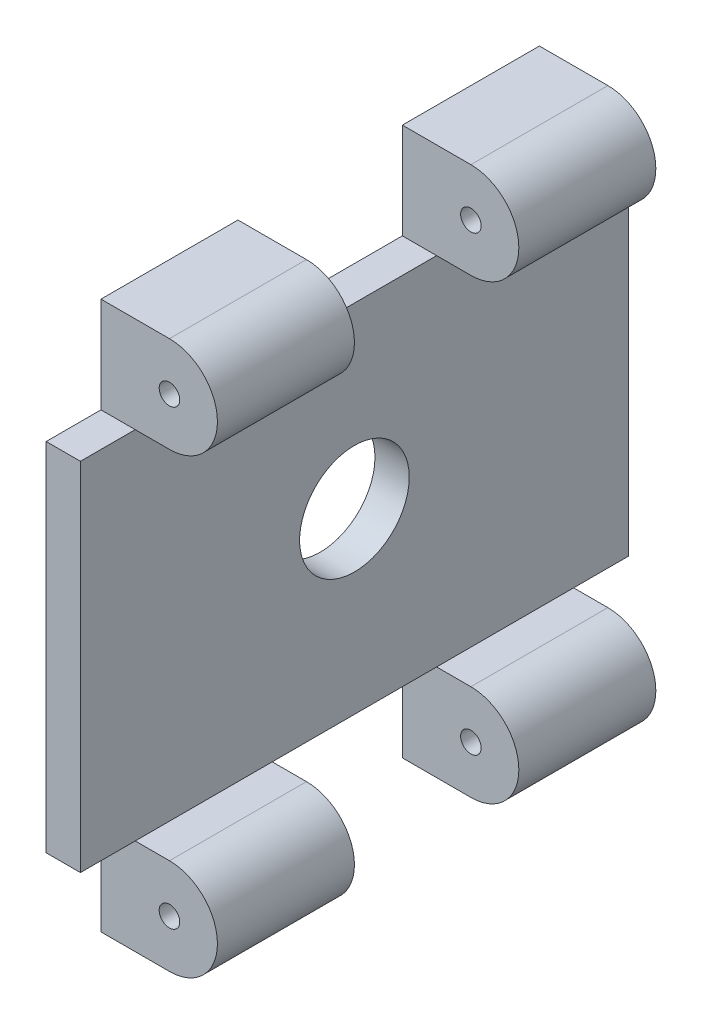
from build123d import *

# Parameters (mm, degrees)
SKETCH_1_W          = 80
SKETCH_1_H          = 80
EXTRUDE_1_DEPTH     = 5
SKETCH_4_R          = 8
CUT_EXTRUDE_2_DEPTH = 5
EXTRUDE_5_DEPTH     = 80
SKETCH_7_W          = 8
SKETCH_7_H          = 14
SKETCH_7_W_2        = 24
CUT_EXTRUDE_3_DEPTH = 80
SKETCH_8_R          = 1.5
CUT_EXTRUDE_4_DEPTH = 80


with BuildPart() as part:
    # 草图1 → 凸台-拉伸1 (new body)
    with BuildSketch(Plane(origin=(0, 0, 0), x_dir=(0, 0, -1), z_dir=(1, 0, 0))):
        Rectangle(SKETCH_1_W, SKETCH_1_H)
    extrude(amount=EXTRUDE_1_DEPTH)

    # 草图4 → 切除-拉伸2 (cut)
    with BuildSketch(Plane(origin=(5, 0, 0), x_dir=(0, 0, -1), z_dir=(1, 0, 0))):
        Circle(SKETCH_4_R)
    extrude(amount=-CUT_EXTRUDE_2_DEPTH, mode=Mode.SUBTRACT)

    # 草图6 → 凸台-拉伸5 (add)
    with BuildSketch(Plane.XY.offset(40)):
        with BuildLine():
            Line((5, -26), (10, -26))
            ThreePointArc((10, -26), (17, -33), (10, -40))
            Line((10, -40), (5, -40))
            Line((5, -40), (5, -26))
        make_face()
        with BuildLine():
            Line((5, 40), (10, 40))
            ThreePointArc((10, 40), (17, 33), (10, 26))
            Line((10, 26), (5, 26))
            Line((5, 26), (5, 40))
        make_face()
    extrude(amount=-EXTRUDE_5_DEPTH)

    # 草图7 → 切除-拉伸3 (cut)
    with BuildSketch(Plane.ZY):
        with Locations((-36, 33)):
            Rectangle(SKETCH_7_W, SKETCH_7_H)
        with Locations((0, 33)):
            Rectangle(SKETCH_7_W_2, SKETCH_7_H)
        with Locations((36, 33)):
            Rectangle(SKETCH_7_W, SKETCH_7_H)
        with Locations((36, -33)):
            Rectangle(SKETCH_7_W, SKETCH_7_H)
        with Locations((0, -33)):
            Rectangle(SKETCH_7_W_2, SKETCH_7_H)
        with Locations((-36, -33)):
            Rectangle(SKETCH_7_W, SKETCH_7_H)
    extrude(amount=-CUT_EXTRUDE_3_DEPTH, mode=Mode.SUBTRACT)

    # 草图8 → 切除-拉伸4 (cut)
    with BuildSketch(Plane.XY.offset(40)):
        with Locations((10, 33)):
            Circle(SKETCH_8_R)
        with Locations((10, -33)):
            Circle(SKETCH_8_R)
    extrude(amount=-CUT_EXTRUDE_4_DEPTH, mode=Mode.SUBTRACT)


solid = part.part
